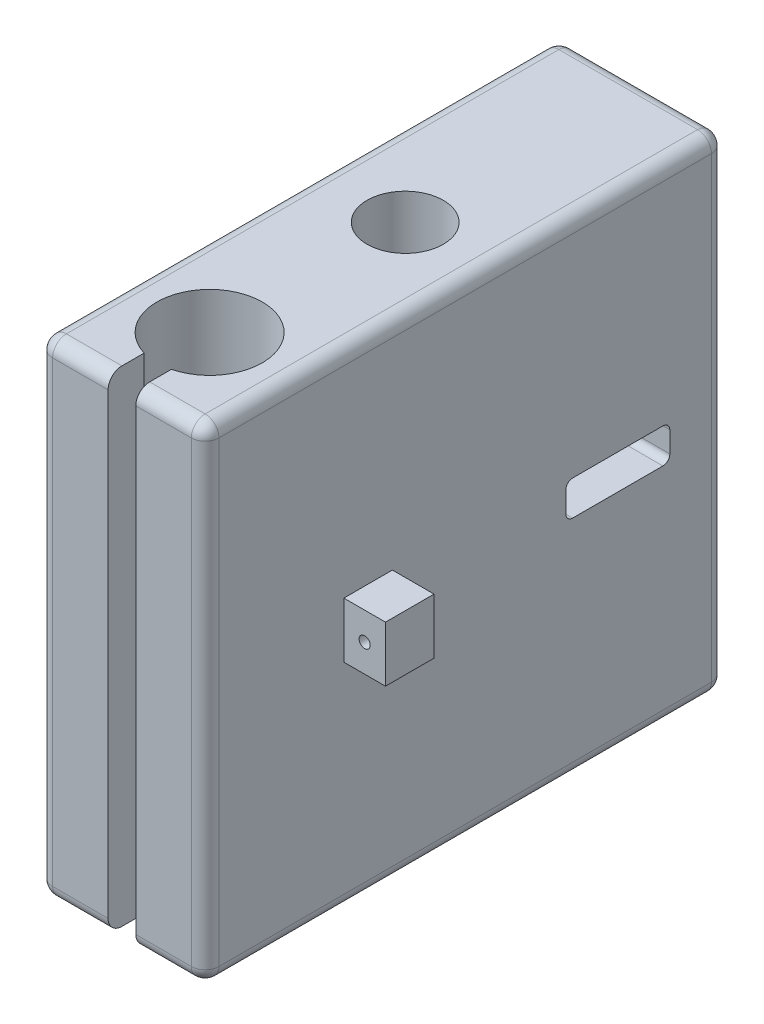
from build123d import *

# Parameters (mm, degrees)
RESSALTO_EXTRUS_O1_DEPTH                   = 12
RESSALTO_EXTRUS_O1_DEPTH_BACK              = 12
ESBO_O1_W                                  = 75
ESBO_O1_H                                  = 70
ESBO_O3_R                                  = 5.5
CORTE_EXTRUS_O1_DEPTH                      = 525.799189678
ESBO_O4_R                                  = 4.1
CORTE_EXTRUS_O2_DEPTH                      = 20
FILETE1_R                                  = 2
CORTE_EXTRUS_O3_DEPTH                      = 29
CORTE_EXTRUS_O4_DEPTH                      = 28
RESSALTO_EXTRUS_O2_DEPTH                   = 6
RESSALTO_EXTRUS_O2_DEPTH_BACK              = 30
ESBO_O7_W                                  = 7
ESBO_O7_H                                  = 8
BROCA_DE_ROSQUEAR_PARA_TARRAXA_DE_M2X0_4_D = 1.6
BROCA_DE_ROSQUEAR_PARA_TARRAXA_DE_M2_2_D   = 1.6


with BuildPart() as part:
    # Esboço1 → Ressalto-extrusão1 (new, two sides: drawn at the far end of the back side and taken through both)
    with BuildSketch(Plane(origin=(-220, 0, 0), x_dir=(0, 0, -1), z_dir=(1, 0, 0)).offset(-RESSALTO_EXTRUS_O1_DEPTH_BACK)):
        with Locations((-427.999935002, 213.253952806)):
            Rectangle(ESBO_O1_W, ESBO_O1_H)
    extrude(amount=RESSALTO_EXTRUS_O1_DEPTH + RESSALTO_EXTRUS_O1_DEPTH_BACK)

    # Esboço3 → Corte-extrusão1 (cut, through all)
    with BuildSketch(Plane(origin=(0, 248.253952806, 0), x_dir=(1, 0, 0), z_dir=(0, 1, 0))):
        with Locations((-219.508549322, -425.149935105)):
            Circle(ESBO_O3_R)
        with BuildLine():
            Line((-220, -465.499935002), (-218, -465.499935002))
            Line((-218, -465.499935002), (-218, -460.369179456))
            ThreePointArc((-218, -460.369179456), (-219.711945476, -445.401349285), (-222, -460.292000844))
            Line((-222, -460.292000844), (-222, -465.499935002))
            Line((-222, -465.499935002), (-220, -465.499935002))
        make_face()
    extrude(amount=-CORTE_EXTRUS_O1_DEPTH, mode=Mode.SUBTRACT)

    # Esboço4 → Corte-extrusão2 (cut)
    with BuildSketch(Plane(origin=(0, 0, 390.499935002), x_dir=(-1, 0, 0), z_dir=(0, 0, -1))):
        with Locations((219.858557552, 238.253952806)):
            Circle(ESBO_O4_R)
        with Locations((219.858557552, 188.253952806)):
            Circle(ESBO_O4_R)
    extrude(amount=-CORTE_EXTRUS_O2_DEPTH, mode=Mode.SUBTRACT)

    # Filete1
    filete1_edges = [part.edges().sort_by_distance(p)[0] for p in [
        (-227, 178.253952806, 465.499935002),
        (-213, 178.253952806, 465.499935002),
        (-213, 248.253952806, 465.499935002),
        (-227, 248.253952806, 465.499935002),
        (-208, 178.253952806, 427.999935002),
        (-208, 248.253952806, 427.999935002),
        (-208, 213.253952806, 465.499935002),
        (-232, 178.253952806, 427.999935002),
        (-232, 213.253952806, 465.499935002),
        (-232, 248.253952806, 427.999935002),
        (-220, 248.253952806, 390.499935002),
        (-220, 178.253952806, 390.499935002),
        (-208, 213.253952806, 390.499935002),
        (-232, 213.253952806, 390.499935002),
    ]]
    fillet(filete1_edges, radius=FILETE1_R)

    # Esboço5 → Corte-extrusão3 (cut)
    with BuildSketch(Plane(origin=(0, 0, 390.499935002), x_dir=(-1, 0, 0), z_dir=(0, 0, -1))):
        Polygon((213.994998516, 195.258589647), (225.994994487, 195.24875544), (226.024497107, 231.248743352), (214.024501137, 231.258577558), align=None)
    extrude(amount=-CORTE_EXTRUS_O3_DEPTH, mode=Mode.SUBTRACT)

    # Esboço6 → Corte-extrusão4 (cut)
    with BuildSketch(Plane.ZY.offset(232)):
        with BuildLine():
            Line((399.499935002, 215.753952806), (412.499935002, 215.753952806))
            ThreePointArc((412.499935002, 215.753952806), (413.207041783, 215.461059587), (413.499935002, 214.753952806))
            Line((413.499935002, 214.753952806), (413.499935002, 211.753952806))
            ThreePointArc((413.499935002, 211.753952806), (413.207041783, 211.046846025), (412.499935002, 210.753952806))
            Line((412.499935002, 210.753952806), (399.499935002, 210.753952806))
            ThreePointArc((399.499935002, 210.753952806), (398.792828221, 211.046846025), (398.499935002, 211.753952806))
            Line((398.499935002, 211.753952806), (398.499935002, 214.753952806))
            ThreePointArc((398.499935002, 214.753952806), (398.792828221, 215.461059587), (399.499935002, 215.753952806))
        make_face()
    extrude(amount=-CORTE_EXTRUS_O4_DEPTH, mode=Mode.SUBTRACT)

    # Esboço7 → Ressalto-extrusão2 (add, two sides: drawn at the far end of the back side and taken through both)
    with BuildSketch(Plane(origin=(-208, 0, 0), x_dir=(0, 0, -1), z_dir=(1, 0, 0)).offset(-RESSALTO_EXTRUS_O2_DEPTH_BACK)):
        with Locations((-441.999935002, 213.253952806)):
            Rectangle(ESBO_O7_W, ESBO_O7_H)
    extrude(amount=RESSALTO_EXTRUS_O2_DEPTH + RESSALTO_EXTRUS_O2_DEPTH_BACK)

    # Broca de rosquear para tarraxa de M2x0.4 (through all)
    with Locations(Plane.XY.offset(445.499935002)):
        with Locations((-205, 213.253952806)):
            Hole(BROCA_DE_ROSQUEAR_PARA_TARRAXA_DE_M2X0_4_D / 2)

    # Broca de rosquear para tarraxa de M2 2 (through all)
    with Locations(Plane.XY.offset(445.499935002)):
        with Locations((-235, 213.253952806)):
            Hole(BROCA_DE_ROSQUEAR_PARA_TARRAXA_DE_M2_2_D / 2)


solid = part.part
